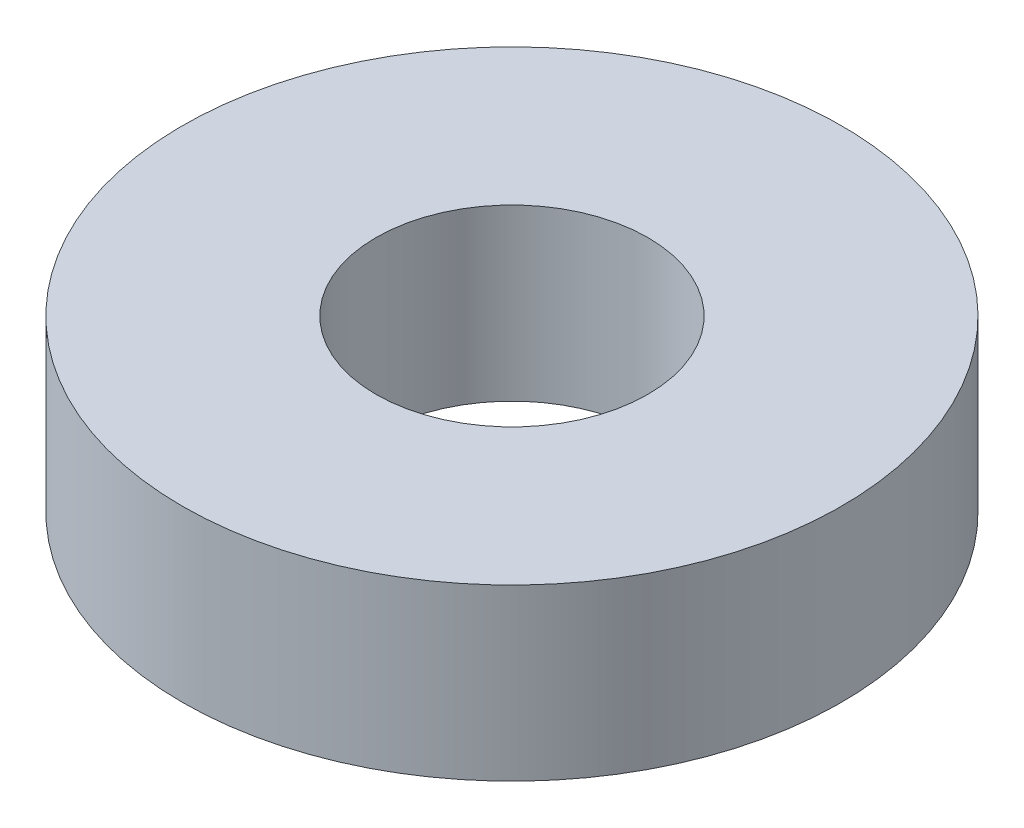
from build123d import *

# Parameters (mm, degrees)
SKETCH_1_R      = 9.7
SKETCH_1_R_2    = 4
EXTRUDE_1_DEPTH = 5


with BuildPart() as part:
    # 스케치1 → 보스-돌출1 (new body)
    with BuildSketch(Plane(origin=(0, 0, 0), x_dir=(1, 0, 0), z_dir=(0, 1, 0))):
        Circle(SKETCH_1_R)
        Circle(SKETCH_1_R_2, mode=Mode.SUBTRACT)
    extrude(amount=EXTRUDE_1_DEPTH)


solid = part.part
